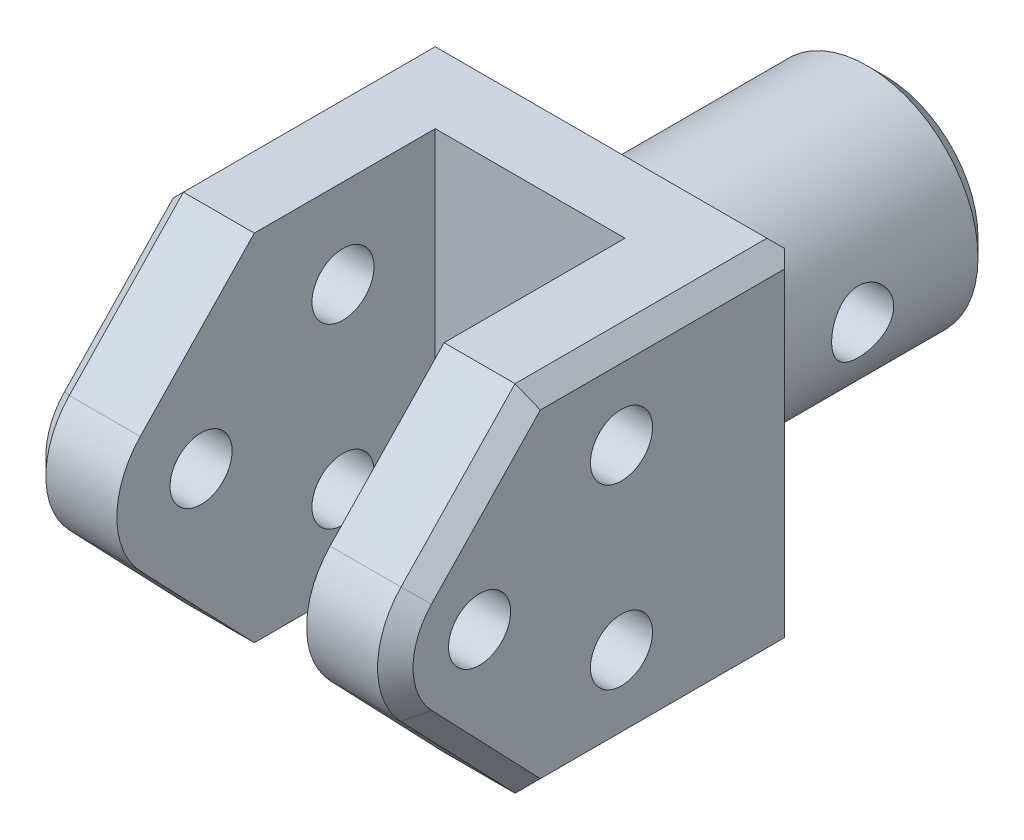
from build123d import *

# Parameters (mm, degrees)
SKETCH_1_R               = 6.25
EXTRUDE_1_DEPTH          = 15
SKETCH_2_W               = 20.7
SKETCH_2_H               = 20
EXTRUDE_2_DEPTH          = 5
SKETCH_3_W               = 5
SKETCH_3_H               = 20
EXTRUDE_3_DEPTH          = 10.2
CUT_EXTRUDE_1_DEPTH      = 21.932331452
CUT_EXTRUDE_1_DEPTH_BACK = 21.932331452
SKETCH_4_R               = 1.75
CUT_EXTRUDE_2_DEPTH      = 21.932331452
CUT_EXTRUDE_2_DEPTH_BACK = 21.932331452
SKETCH_5_R               = 1.75
SKETCH_6_R               = 1.75
EXTRUDE_4_DEPTH          = 5
CHAMFER_1_SIZE           = 1
CHAMFER_2_SIZE           = 1
CHAMFER_3_SIZE           = 1


with BuildPart() as part:
    # ｽｹｯﾁ1 → ﾎﾞｽ - 押し出し1 (new body)
    with BuildSketch(Plane.XY):
        Circle(SKETCH_1_R)
    extrude(amount=-EXTRUDE_1_DEPTH)

    # ｽｹｯﾁ2 → ﾎﾞｽ - 押し出し2 (add)
    with BuildSketch(Plane.XY):
        Rectangle(SKETCH_2_W, SKETCH_2_H)
    extrude(amount=EXTRUDE_2_DEPTH)

    # ｽｹｯﾁ3 → ﾎﾞｽ - 押し出し3 (add)
    with BuildSketch(Plane.XY.offset(5)):
        with Locations((7.85, 0)):
            Rectangle(SKETCH_3_W, SKETCH_3_H)
        with Locations((-7.85, 0)):
            Rectangle(SKETCH_3_W, SKETCH_3_H)
    extrude(amount=EXTRUDE_3_DEPTH)

    # ｽｹｯﾁ4 → ｶｯﾄ - 押し出し1 (cut, two sides: drawn at the far end of the back side and taken through both)
    with BuildSketch(Plane(origin=(0, 0, 0), x_dir=(0, 0, -1), z_dir=(1, 0, 0)).offset(-CUT_EXTRUDE_1_DEPTH_BACK)):
        with Locations((-10.2, 5)):
            Circle(SKETCH_4_R)
        with Locations((-10.2, -5)):
            Circle(SKETCH_4_R)
    extrude(amount=CUT_EXTRUDE_1_DEPTH + CUT_EXTRUDE_1_DEPTH_BACK, mode=Mode.SUBTRACT)

    # ｽｹｯﾁ5 → ｶｯﾄ - 押し出し2 (cut, two sides: drawn at the far end of the back side and taken through both)
    with BuildSketch(Plane(origin=(0, 0, 0), x_dir=(0, 0, -1), z_dir=(1, 0, 0)).offset(-CUT_EXTRUDE_2_DEPTH_BACK)):
        with Locations((7.5, 0)):
            Circle(SKETCH_5_R)
    extrude(amount=CUT_EXTRUDE_2_DEPTH + CUT_EXTRUDE_2_DEPTH_BACK, mode=Mode.SUBTRACT)

    # ｽｹｯﾁ6 → ﾎﾞｽ - 押し出し4 (add)
    with BuildSketch(Plane.ZY.offset(10.35)):
        with BuildLine():
            Line((15.2, 10), (21.630535845, 3.285410753))
            ThreePointArc((21.630535845, 3.285410753), (22.95, 0), (21.630535845, -3.285410753))
            Line((21.630535845, -3.285410753), (15.2, -10))
            Line((15.2, -10), (15.2, 10))
        make_face()
        with Locations((18.2, 0)):
            Circle(SKETCH_6_R, mode=Mode.SUBTRACT)
    extrude_4 = extrude(amount=-EXTRUDE_4_DEPTH)

    # ﾐﾗｰ1: ﾎﾞｽ - 押し出し4 across plane
    add(extrude_4.mirror(Plane(origin=(0, 0, 0), x_dir=(0, 0, 1), z_dir=(1, 0, 0))))

    # 面取り1
    chamfer_1_edges = [part.edges().sort_by_distance(p)[0] for p in [
        (0, 10, 0),
        (-10.35, 0, 0),
        (0, -10, 0),
        (10.35, 0, 0),
    ]]
    chamfer(chamfer_1_edges, length=CHAMFER_1_SIZE)

    # 面取り2
    chamfer_2_edges = [part.edges().sort_by_distance(p)[0] for p in [
        (10.35, 10, 8.1),
        (10.35, -10, 8.1),
        (-10.35, 10, 8.1),
        (-10.35, -10, 8.1),
        (10.35, 6.642705377, 18.415267922),
        (10.35, 0, 22.95),
        (10.35, -6.642705377, 18.415267922),
        (-10.35, 6.642705377, 18.415267922),
        (-10.35, 0, 22.95),
        (-10.35, -6.642705377, 18.415267922),
    ]]
    chamfer(chamfer_2_edges, length=CHAMFER_2_SIZE)

    # 面取り3
    chamfer_3_edges = [part.edges().sort_by_distance(p)[0] for p in [
        (-6.25, 0, -15),
    ]]
    chamfer(chamfer_3_edges, length=CHAMFER_3_SIZE)


solid = part.part
